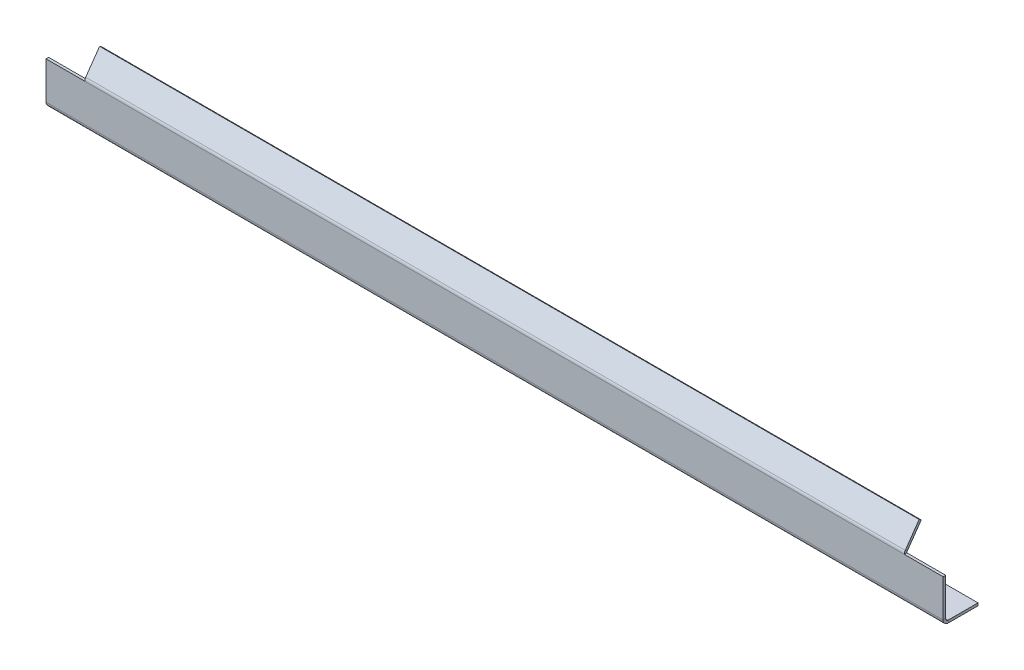
from build123d import *

# Parameters (mm, degrees)
SKETCH1_W                    = 694
SKETCH1_H                    = 33
BASE_FLANGE1_DEPTH           = 2
EDGE_FLANGE1_STRIP_W         = 12
EDGE_FLANGE1_STRIP_H         = 2
EDGE_FLANGE1_STRIP_CUT_DEPTH = 694
EDGE_FLANGE1_DEPTH           = 694
EDGE_FLANGE2_DEPTH           = 634


# Sheet-metal steps are written as plain solids
with BuildPart() as part:
    # Sketch1 → Base-Flange1 (new body)
    with BuildSketch(Plane.XY):
        Rectangle(SKETCH1_W, SKETCH1_H)
    extrude(amount=BASE_FLANGE1_DEPTH)

    # Edge-Flange1 strip (across the edge) → Edge-Flange1 strip cut (cut)
    with BuildSketch(Plane(origin=(347, -16.5, 0), x_dir=(0, 1, 0), z_dir=(-1, 0, 0))):
        with Locations((-2, -1)):
            Rectangle(EDGE_FLANGE1_STRIP_W, EDGE_FLANGE1_STRIP_H)
    extrude(amount=EDGE_FLANGE1_STRIP_CUT_DEPTH, mode=Mode.SUBTRACT)

    # Edge-Flange1 section (across the edge) → Edge-Flange1 (add)
    with BuildSketch(Plane(origin=(347, -16.5, 0), x_dir=(0, 1, 0), z_dir=(-1, 0, 0))):
        with BuildLine():
            Line((0, 2), (0, 25))
            Line((0, 25), (2, 25))
            Line((2, 25), (2, 2))
            ThreePointArc((2, 2), (2.585786438, 0.585786438), (4, 0))
            Line((4, 0), (4, -2))
            ThreePointArc((4, -2), (1.171572875, -0.828427125), (0, 2))
        make_face()
    extrude(amount=EDGE_FLANGE1_DEPTH)

    # Edge-Flange2 section (across the edge) → Edge-Flange2 (add)
    with BuildSketch(Plane(origin=(-317, 17.130597578, 0), x_dir=(0, -0.5735764363510416, -0.8191520442889949), z_dir=(1, 0, 0))):
        with BuildLine():
            Line((-2, 0.630597578), (-2, 19.369402422))
            Line((-2, 19.369402422), (0, 19.369402422))
            Line((0, 19.369402422), (0, 0.630597578))
            ThreePointArc((0, 0.630597578), (0.092566099, 0.029185979), (0.361695911, -0.516555295))
            Line((0.361695911, -0.516555295), (-1.276608177, -1.663708168))
            ThreePointArc((-1.276608177, -1.663708168), (-1.814867803, -0.57222562), (-2, 0.630597578))
        make_face()
    extrude(amount=EDGE_FLANGE2_DEPTH)


solid = part.part
